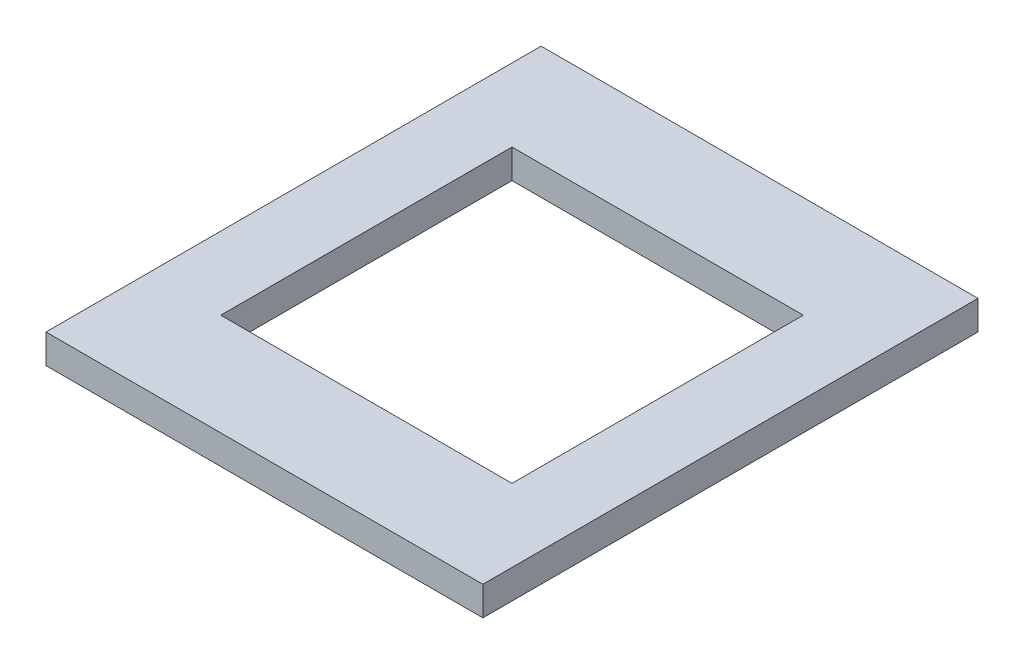
from build123d import *

# Parameters (mm, degrees)
SKETCH1_W           = 150
SKETCH1_H           = 30
BOSS_EXTRUDE1_DEPTH = 10
SKETCH9_W           = 150
SKETCH9_H           = 170
SKETCH9_W_2         = 100
SKETCH9_H_2         = 100
BOSS_EXTRUDE3_DEPTH = 10
SKETCH25_W          = 150
SKETCH25_H          = 30
CUT_EXTRUDE2_DEPTH  = 10


with BuildPart() as part:
    # Sketch1 → Boss-Extrude1 (new body)
    with BuildSketch(Plane(origin=(0, 0, 0), x_dir=(1, 0, 0), z_dir=(0, 1, 0))):
        with Locations((-75, 15)):
            Rectangle(SKETCH1_W, SKETCH1_H)
    extrude(amount=BOSS_EXTRUDE1_DEPTH)

    # Sketch9 → Boss-Extrude3 (add)
    with BuildSketch(Plane.XZ):
        with Locations((-75, -15)):
            Rectangle(SKETCH9_W, SKETCH9_H)
        with Locations((-75, -15)):
            Rectangle(SKETCH9_W_2, SKETCH9_H_2, mode=Mode.SUBTRACT)
    extrude(amount=BOSS_EXTRUDE3_DEPTH)

    # Sketch25 → Cut-Extrude2 (cut)
    with BuildSketch(Plane(origin=(0, 0, 0), x_dir=(1, 0, 0), z_dir=(0, 1, 0))):
        with Locations((-75, 15)):
            Rectangle(SKETCH25_W, SKETCH25_H)
    extrude(amount=CUT_EXTRUDE2_DEPTH, mode=Mode.SUBTRACT)


solid = part.part
